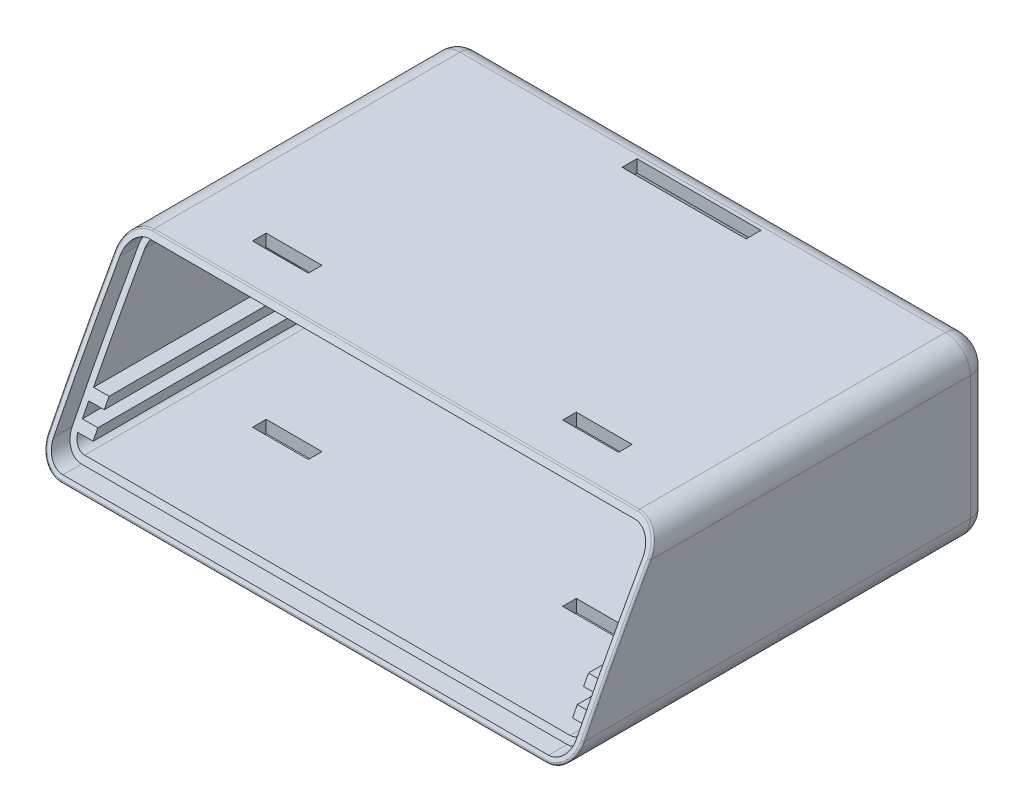
from build123d import *

# Parameters (mm, degrees)
SKETCH1_W                = 86.28
SKETCH1_H                = 67.5
BOSS_EXTRUDE1_DEPTH      = 28
FILLET1_R                = 4
SHELL1_T                 = -2
CUT_EXTRUDE1_DEPTH       = 97.784817508
SKETCH3_W                = 14.3
SKETCH3_H                = 16.7
SKETCH3_W_2              = 11.05
SKETCH3_H_2              = 14.049996967
CUT_EXTRUDE2_DEPTH       = 2
FILLET2_R                = 3
CUT_EXTRUDE3_REACH       = 165.279
CUT_EXTRUDE3_END_RADIUS  = 475
CUT_EXTRUDE3_START       = 80
FILLET3_R                = 0.3
BOSS_EXTRUDE2_REACH      = 85.135
BOSS_EXTRUDE2_END_RADIUS = 475
SKETCH5_W                = 2.5
SKETCH5_H                = 1.5
SKETCH6_W                = 9
SKETCH6_H                = 2.2
CUT_EXTRUDE4_DEPTH       = 62.515218558
SKETCH7_W                = 20
SKETCH7_H                = 2.4
CUT_EXTRUDE5_DEPTH       = 2


with BuildPart() as part:
    # Sketch1 → Boss-Extrude1 (new body)
    with BuildSketch(Plane(origin=(0, 0, 0), x_dir=(1, 0, 0), z_dir=(0, 1, 0))):
        Rectangle(SKETCH1_W, SKETCH1_H)
    extrude(amount=BOSS_EXTRUDE1_DEPTH)

    # Fillet1
    fillet1_edges = [part.edges().sort_by_distance(p)[0] for p in [
        (-43.14, 28, 0),
        (43.14, 28, 0),
        (-43.14, 0, 0),
        (43.14, 0, 0),
    ]]
    fillet(fillet1_edges, radius=FILLET1_R)

    # Shell1
    shell1_openings = [part.faces().sort_by_distance(p)[0] for p in [
        (0, 14, 33.75),
    ]]
    offset(amount=SHELL1_T, openings=shell1_openings, kind=Kind.INTERSECTION)

    # Sketch2 → Cut-Extrude1 (cut, through all)
    with BuildSketch(Plane.ZY.offset(43.14)):
        with BuildLine():
            Line((18.75, 28), (33.75, 28))
            Line((33.75, 28), (33.75, 0))
            ThreePointArc((33.75, 0), (26.484121584, 14.125422277), (18.75, 28))
        make_face()
    extrude(amount=-CUT_EXTRUDE1_DEPTH, mode=Mode.SUBTRACT)

    # Sketch3 → Cut-Extrude2 (cut)
    with BuildSketch(Plane(origin=(0, 0, -33.75), x_dir=(-1, 0, 0), z_dir=(0, 0, -1))):
        with Locations((0, 10.35)):
            Rectangle(SKETCH3_W, SKETCH3_H)
        with Locations((32.775, 10.175001517)):
            Rectangle(SKETCH3_W_2, SKETCH3_H_2)
    extrude(amount=-CUT_EXTRUDE2_DEPTH, mode=Mode.SUBTRACT)

    # Fillet2
    # the kernel refuses this fillet: 3 mm, written as the material it takes off along each edge
    with BuildSketch(Plane(origin=(39.14, 24, -33.75), x_dir=(1, 0, 0), z_dir=(0, -1, 0))) as fillet2_piece_1:
        with BuildLine():
            CenterArc((4 - FILLET2_R, FILLET2_R), FILLET2_R, 270, 90)
            Line((4, FILLET2_R), (4, 0))
            Line((4, 0), (4 - FILLET2_R, 0))
        make_face()
    revolve(axis=Axis((39.14, 24, -33.75), (0, 0, 1)), revolution_arc=90, mode=Mode.SUBTRACT)
    with BuildSketch(Plane(origin=(43.14, 4, -33.75), x_dir=(-1, 0, 0), z_dir=(0, 1, 0)), Plane(origin=(-43.14, 4, -33.75), x_dir=(0, 0, 1), z_dir=(0, 1, 0))) as fillet2_piece_2:
        with BuildLine():
            CenterArc((FILLET2_R, FILLET2_R), FILLET2_R, 180, 90)
            Line((0, FILLET2_R), (0, 0))
            Line((0, 0), (FILLET2_R, 0))
        make_face()
    extrude(amount=20, mode=Mode.SUBTRACT)
    with BuildSketch(Plane(origin=(39.14, 4, -33.75), x_dir=(1, 0, 0), z_dir=(0, 1, 0))) as fillet2_piece_3:
        with BuildLine():
            CenterArc((4 - FILLET2_R, -FILLET2_R), FILLET2_R, 0, 90)
            Line((4, -FILLET2_R), (4, 0))
            Line((4, 0), (4 - FILLET2_R, 0))
        make_face()
    revolve(axis=Axis((39.14, 4, -33.75), (0, 0, -1)), revolution_arc=90, mode=Mode.SUBTRACT)
    with BuildSketch(Plane(origin=(39.14, 0, -33.75), x_dir=(0, 1, 0), z_dir=(-1, 0, 0))) as fillet2_piece_4:
        with BuildLine():
            CenterArc((FILLET2_R, -FILLET2_R), FILLET2_R, 90, 90)
            Line((0, -FILLET2_R), (0, 0))
            Line((0, 0), (FILLET2_R, 0))
        make_face()
    extrude(amount=78.28, mode=Mode.SUBTRACT)
    with BuildSketch(Plane(origin=(-39.14, 4, -33.75), x_dir=(-1, 0, 0), z_dir=(0, 1, 0))) as fillet2_piece_5:
        with BuildLine():
            CenterArc((4 - FILLET2_R, FILLET2_R), FILLET2_R, 270, 90)
            Line((4 - FILLET2_R, 0), (4, 0))
            Line((4, 0), (4, FILLET2_R))
        make_face()
    revolve(axis=Axis((-39.14, 4, -33.75), (0, 0, 1)), revolution_arc=90, mode=Mode.SUBTRACT)
    with BuildSketch(Plane(origin=(-39.14, 24, -33.75), x_dir=(-1, 0, 0), z_dir=(0, -1, 0))) as fillet2_piece_6:
        with BuildLine():
            CenterArc((4 - FILLET2_R, -FILLET2_R), FILLET2_R, 0, 90)
            Line((4 - FILLET2_R, 0), (4, 0))
            Line((4, 0), (4, -FILLET2_R))
        make_face()
    revolve(axis=Axis((-39.14, 24, -33.75), (0, 0, -1)), revolution_arc=90, mode=Mode.SUBTRACT)
    with BuildSketch(Plane(origin=(39.14, 28, -33.75), x_dir=(0, -1, 0), z_dir=(-1, 0, 0))) as fillet2_piece_7:
        with BuildLine():
            CenterArc((FILLET2_R, FILLET2_R), FILLET2_R, 180, 90)
            Line((0, FILLET2_R), (0, 0))
            Line((0, 0), (FILLET2_R, 0))
        make_face()
    extrude(amount=78.28, mode=Mode.SUBTRACT)

    # Cut-Extrude3: up to this cylinder (the profile starts outside it)
    cut_extrude3_end = Plane(origin=(-23.145, -210.179748667, -395.218864179), z_dir=(-1, 0, 0)) * Cylinder(CUT_EXTRUDE3_END_RADIUS, 1281.558, mode=Mode.PRIVATE)
    # Sketch4 → Cut-Extrude3 (cut, up to the surface)
    with BuildSketch(Plane.XY.offset(-31.75).offset(CUT_EXTRUDE3_START), mode=Mode.PRIVATE) as cut_extrude3_sk1:
        with BuildLine():
            Line((-7.15, 1), (7.15, 1))
            Line((7.15, 1), (39.14, 1))
            ThreePointArc((39.14, 1), (41.261320344, 1.878679656), (42.14, 4))
            Line((42.14, 4), (42.14, 24))
            ThreePointArc((42.14, 24), (41.261320344, 26.121320344), (39.14, 27))
            Line((39.14, 27), (-39.14, 27))
            ThreePointArc((-39.14, 27), (-41.261320344, 26.121320344), (-42.14, 24))
            Line((-42.14, 24), (-42.14, 4))
            ThreePointArc((-42.14, 4), (-41.261320344, 1.878679656), (-39.14, 1))
            Line((-39.14, 1), (-7.15, 1))
        make_face()
        with BuildLine():
            Line((-7.15, 2), (7.15, 2))
            Line((7.15, 2), (39.14, 2))
            ThreePointArc((39.14, 2), (40.554213562, 2.585786438), (41.14, 4))
            Line((41.14, 4), (41.14, 24))
            ThreePointArc((41.14, 24), (40.554213562, 25.414213562), (39.14, 26))
            Line((39.14, 26), (-39.14, 26))
            ThreePointArc((-39.14, 26), (-40.554213562, 25.414213562), (-41.14, 24))
            Line((-41.14, 24), (-41.14, 4))
            ThreePointArc((-41.14, 4), (-40.554213562, 2.585786438), (-39.14, 2))
            Line((-39.14, 2), (-7.15, 2))
        make_face(mode=Mode.SUBTRACT)
    cut_extrude3_tool1 = extrude(cut_extrude3_sk1.sketch, amount=-CUT_EXTRUDE3_REACH, mode=Mode.PRIVATE) - cut_extrude3_end
    add(cut_extrude3_tool1.solids().sort_by_distance((-23.145, 1.881993, 48.25))[0], mode=Mode.SUBTRACT)

    # Fillet3
    fillet3_edges = [part.edges().sort_by_distance(p)[0] for p in [
        (0, 0, 33.75),
        (-43.14, 14.0639546, 26.517044891),
        (42.064985447, 26.728453829, 19.484309952),
        (42.046759663, 1.252137501, 33.12988391),
        (-42.046759662, 1.252137501, 33.12988391),
        (-42.064985447, 26.728453829, 19.484309952),
        (43.14, 14.0639546, 26.517044891),
        (0, 28, 18.75),
    ]]
    fillet(fillet3_edges, radius=FILLET3_R)

    # Boss-Extrude2: up to this cylinder (the profile starts inside it)
    boss_extrude2_end = Plane(origin=(0, -210.179748667, -395.218864179), z_dir=(-1, 0, 0)) * Cylinder(BOSS_EXTRUDE2_END_RADIUS, 1201.05, mode=Mode.PRIVATE)
    # Sketch5 → Boss-Extrude2 (add, up to the surface)
    with BuildSketch(Plane.XY.offset(-31.75), mode=Mode.PRIVATE) as boss_extrude2_sk1:
        with Locations((39.89, 4.5)):
            Rectangle(SKETCH5_W, SKETCH5_H)
    boss_extrude2_tool1 = extrude(boss_extrude2_sk1.sketch, amount=BOSS_EXTRUDE2_REACH, mode=Mode.PRIVATE) & boss_extrude2_end
    add(boss_extrude2_tool1.solids().sort_by_distance((39.89, 4.5, -31.75))[0])
    # Sketch5 → Boss-Extrude2 (add, up to the surface)
    with BuildSketch(Plane.XY.offset(-31.75), mode=Mode.PRIVATE) as boss_extrude2_sk2:
        with Locations((39.89, 8)):
            Rectangle(SKETCH5_W, SKETCH5_H)
    boss_extrude2_tool2 = extrude(boss_extrude2_sk2.sketch, amount=BOSS_EXTRUDE2_REACH, mode=Mode.PRIVATE) & boss_extrude2_end
    add(boss_extrude2_tool2.solids().sort_by_distance((39.89, 8, -31.75))[0])
    # Sketch5 → Boss-Extrude2 (add, up to the surface)
    with BuildSketch(Plane.XY.offset(-31.75), mode=Mode.PRIVATE) as boss_extrude2_sk3:
        with Locations((-39.89, 8)):
            Rectangle(SKETCH5_W, SKETCH5_H)
    boss_extrude2_tool3 = extrude(boss_extrude2_sk3.sketch, amount=BOSS_EXTRUDE2_REACH, mode=Mode.PRIVATE) & boss_extrude2_end
    add(boss_extrude2_tool3.solids().sort_by_distance((-39.89, 8, -31.75))[0])
    # Sketch5 → Boss-Extrude2 (add, up to the surface)
    with BuildSketch(Plane.XY.offset(-31.75), mode=Mode.PRIVATE) as boss_extrude2_sk4:
        with Locations((-39.89, 4.5)):
            Rectangle(SKETCH5_W, SKETCH5_H)
    boss_extrude2_tool4 = extrude(boss_extrude2_sk4.sketch, amount=BOSS_EXTRUDE2_REACH, mode=Mode.PRIVATE) & boss_extrude2_end
    add(boss_extrude2_tool4.solids().sort_by_distance((-39.89, 4.5, -31.75))[0])

    # Sketch6 → Cut-Extrude4 (cut, through all)
    with BuildSketch(Plane(origin=(0, 28, 0), x_dir=(1, 0, 0), z_dir=(0, 1, 0))):
        with Locations((25, -11.23)):
            Rectangle(SKETCH6_W, SKETCH6_H)
        with Locations((-25, -11.23)):
            Rectangle(SKETCH6_W, SKETCH6_H)
    extrude(amount=-CUT_EXTRUDE4_DEPTH, mode=Mode.SUBTRACT)

    # Sketch7 → Cut-Extrude5 (cut)
    with BuildSketch(Plane(origin=(0, 28, 0), x_dir=(1, 0, 0), z_dir=(0, 1, 0))):
        with Locations((0, 28.95)):
            Rectangle(SKETCH7_W, SKETCH7_H)
    extrude(amount=-CUT_EXTRUDE5_DEPTH, mode=Mode.SUBTRACT)


solid = part.part
